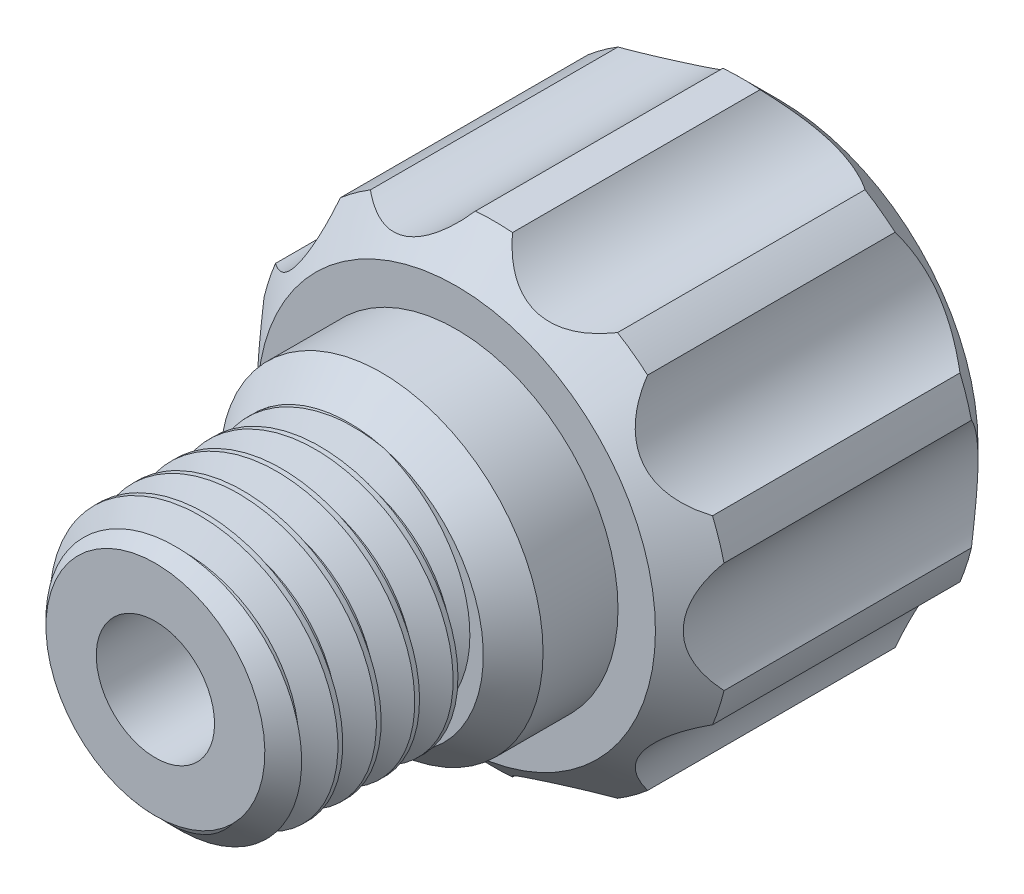
from build123d import *

# Parameters (mm, degrees)
SKETCH1_R           = 3.175
EXTRUDE1_DEPTH      = 4.572
CUT_SWEEP1_PITCH    = 0.907142857
EXTRUDE2_DEPTH      = 7.62
SKETCH10_R          = 3.817056353
CUT_EXTRUDE1_DEPTH  = 6.5024
BOSS_EXTRUDE2_REACH = 19.685
SKETCH11_R          = 2.0574
BOSS_EXTRUDE2_DRAFT = 1
SKETCH18_R          = 3.817056353
BOSS_EXTRUDE3_DEPTH = 1.770943647
SKETCH16_R          = 1.397
CUT_EXTRUDE2_DEPTH  = 18.685174916
SKETCH17_OUTSIDE_W  = 22.398
SKETCH17_OUTSIDE_H  = 22.706
SKETCH17_OUTSIDE_R  = 2.585793431
CUT_EXTRUDE3_DEPTH  = 2.54
CUT_EXTRUDE3_DRAFT  = -45


with BuildPart() as part:
    # Sketch1 → Extrude1 (new body)
    with BuildSketch(Plane.XY.offset(7.9375)):
        Circle(SKETCH1_R)
    extrude(amount=-EXTRUDE1_DEPTH)

    # Cut-Sweep1: the profile of Sketch3 profile screwed along a right-hand helix of 6.04 turns, 6 arcs to a turn; built about Z, then put on its axis
    cut_sweep1_z = Axis((0, 0, 0), (0, 0, 1))
    cut_sweep1_corners = [(3.1753, 0, -0.793923205), (2.585793431, 0, -0.453571429), (2.585793431, 0, -0.340178571), (3.1753, 0, 0.000173205)]
    with BuildLine(mode=Mode.PRIVATE) as cut_sweep1_profile:
        Line(cut_sweep1_corners[0], cut_sweep1_corners[1])
        Line(cut_sweep1_corners[1], cut_sweep1_corners[2])
        Line(cut_sweep1_corners[2], cut_sweep1_corners[3])
        Line(cut_sweep1_corners[3], cut_sweep1_corners[0])
    cut_sweep1_cap = Face(cut_sweep1_profile.wire())
    cut_sweep1_turn_angles = [0, 30, 60, 90, 120, 150, 180, 210, 240, 270, 300, 330, 360]
    cut_sweep1_turn_weights = [1, 0.8660254037844387, 1, 0.8660254037844387, 1, 0.8660254037844387, 1, 0.8660254037844387, 1, 0.8660254037844387, 1, 0.8660254037844387, 1]
    cut_sweep1_turn_rails = [Edge.make_bspline([Vector(p[0], p[1], 0).rotate(cut_sweep1_z, cut_sweep1_turn_angles[k]) / cut_sweep1_turn_weights[k] + Vector(0, 0, p[2] + CUT_SWEEP1_PITCH * cut_sweep1_turn_angles[k] / 360) for k in range(13)], [0, 0, 0, 1, 1, 2, 2, 3, 3, 4, 4, 5, 5, 6, 6, 6], 2, cut_sweep1_turn_weights) for p in cut_sweep1_corners]
    cut_sweep1_turn_sides = [Face.make_surface_from_curves(cut_sweep1_turn_rails[p[0]], cut_sweep1_turn_rails[p[1]]) for p in [(0, 1), (1, 2), (2, 3), (3, 0)]]
    cut_sweep1_last_angles = [2160, 2167.2, 2174.4]
    cut_sweep1_last_weights = [1, 0.9921147013144728, 1]
    cut_sweep1_last_rails = [Edge.make_bspline([Vector(p[0], p[1], 0).rotate(cut_sweep1_z, cut_sweep1_last_angles[k]) / cut_sweep1_last_weights[k] + Vector(0, 0, p[2] + CUT_SWEEP1_PITCH * cut_sweep1_last_angles[k] / 360) for k in range(3)], [0, 0, 0, 1, 1, 1], 2, cut_sweep1_last_weights) for p in cut_sweep1_corners]
    cut_sweep1_last_sides = [Face.make_surface_from_curves(cut_sweep1_last_rails[p[0]], cut_sweep1_last_rails[p[1]]) for p in [(0, 1), (1, 2), (2, 3), (3, 0)]]
    cut_sweep1 = Plane(origin=(0, 0, 7.9375), x_dir=(0, 1, 0), z_dir=(0, 0, -1)) * Solid(Shell([*[p.moved(Location((0, 0, CUT_SWEEP1_PITCH * i))) for i in range(6) for p in cut_sweep1_turn_sides], *cut_sweep1_last_sides, cut_sweep1_cap, cut_sweep1_cap.rotate(cut_sweep1_z, 2174.4).moved(Location((0, 0, CUT_SWEEP1_PITCH * 2174.4 / 360)))]))
    add(cut_sweep1, mode=Mode.SUBTRACT)



with BuildPart() as body_2:
    # Sketch6 → Extrude2 (new body)
    with BuildSketch(Plane(origin=(0, 0, 0.8255), x_dir=(-1, 0, 0), z_dir=(0, 0, -1))):
        with BuildLine():
            ThreePointArc((-0.438429427, 5.570774061), (0, 5.588), (0.438429427, 5.570774061))
            ThreePointArc((0.438429427, 5.570774061), (1.554108268, 4.783053432), (2.91972198, 4.764553238))
            ThreePointArc((2.91972198, 4.764553238), (3.28454399, 4.520786965), (3.629115694, 4.249148536))
            ThreePointArc((3.629115694, 4.249148536), (4.068708268, 2.956089591), (5.162638828, 2.13843502))
            ThreePointArc((5.162638828, 2.13843502), (5.314503813, 1.726786965), (5.433603115, 1.304492693))
            ThreePointArc((5.433603115, 1.304492693), (5.0292, 0), (5.433603115, -1.304492693))
            ThreePointArc((5.433603115, -1.304492693), (5.314503813, -1.726786965), (5.162638828, -2.13843502))
            ThreePointArc((5.162638828, -2.13843502), (4.068708268, -2.956089591), (3.629115694, -4.249148536))
            ThreePointArc((3.629115694, -4.249148536), (3.28454399, -4.520786965), (2.91972198, -4.764553238))
            ThreePointArc((2.91972198, -4.764553238), (1.554108268, -4.783053432), (0.438429427, -5.570774061))
            ThreePointArc((0.438429427, -5.570774061), (0, -5.588), (-0.438429427, -5.570774061))
            ThreePointArc((-0.438429427, -5.570774061), (-1.554108268, -4.783053432), (-2.91972198, -4.764553238))
            ThreePointArc((-2.91972198, -4.764553238), (-3.28454399, -4.520786965), (-3.629115694, -4.249148536))
            ThreePointArc((-3.629115694, -4.249148536), (-4.068708268, -2.956089591), (-5.162638828, -2.13843502))
            ThreePointArc((-5.162638828, -2.13843502), (-5.314503813, -1.726786965), (-5.433603115, -1.304492693))
            ThreePointArc((-5.433603115, -1.304492693), (-5.0292, 0), (-5.433603115, 1.304492693))
            ThreePointArc((-5.433603115, 1.304492693), (-5.314503813, 1.726786965), (-5.162638828, 2.13843502))
            ThreePointArc((-5.162638828, 2.13843502), (-4.068708268, 2.956089591), (-3.629115694, 4.249148536))
            ThreePointArc((-3.629115694, 4.249148536), (-3.28454399, 4.520786965), (-2.91972198, 4.764553238))
            ThreePointArc((-2.91972198, 4.764553238), (-1.554108268, 4.783053432), (-0.438429427, 5.570774061))
        make_face()
    extrude(amount=EXTRUDE2_DEPTH)

    # Sketch10 → Cut-Extrude1 (cut)
    with BuildSketch(Plane(origin=(0, 0, -6.7945), x_dir=(-1, 0, 0), z_dir=(0, 0, -1))):
        Circle(SKETCH10_R)
    extrude(amount=-CUT_EXTRUDE1_DEPTH, mode=Mode.SUBTRACT)




with BuildPart() as boss_extrude2_long_prism_1:
    # Sketch11 → Boss-Extrude2 (the long prism of profile 1, to be tilted and cut off)
    with BuildSketch(Plane(origin=(0, 0, -7.9375), x_dir=(-1, 0, 0), z_dir=(0, 0, -1))):
        Circle(SKETCH11_R)
    extrude(amount=-BOSS_EXTRUDE2_REACH)
    boss_extrude2_tool1_sides = [boss_extrude2_long_prism_1.faces().sort_by_distance(p)[0] for p in [
        (2.0574, 0, 1.905),
    ]]
    draft(boss_extrude2_tool1_sides, Plane(origin=(0, 0, -7.9375), x_dir=(-1, 0, 0), z_dir=(0, 0, -1)), BOSS_EXTRUDE2_DRAFT)  # the draft: side faces tilted about the start plane


with BuildPart() as body_2_1:
    add(body_2.part)
    boss_extrude2_tool1 = boss_extrude2_long_prism_1.part - body_2.part
    add(boss_extrude2_tool1.solids().sort_by_distance((0, 0, -7.9375))[0])

    # Sketch18 → Boss-Extrude3 (add)
    with BuildSketch(Plane.XY.offset(0.8255)):
        with Locations(Location((0, 0, 0), (0, 0, 180))):
            Circle(SKETCH18_R)
    extrude(amount=BOSS_EXTRUDE3_DEPTH)


with BuildPart() as part_1:
    add(part.part)

    add(body_2_1.part)  # Revolve1 merges body 2
    # Sketch15 → Revolve1 (revolve)
    with BuildSketch(Plane(origin=(0, 0, 0), x_dir=(0, 0, -1), z_dir=(1, 0, 0)), mode=Mode.PRIVATE) as revolve1_sk:
        Polygon((-3.3655, 0), (-3.3655, 3.175), (-2.596443647, 3.817056353), (-2.596443647, 0), align=None)
    revolve(revolve1_sk.sketch.rotate(Axis((0, 0, 7.9375), (0, 0, -1)), 14.929937855), axis=Axis((0, 0, 7.9375), (0, 0, -1)))

    # Sketch16 → Cut-Extrude2 (cut, through all)
    with BuildSketch(Plane.XY.offset(7.9375)):
        Circle(SKETCH16_R)
    extrude(amount=-CUT_EXTRUDE2_DEPTH, mode=Mode.SUBTRACT)


with BuildPart() as cut_extrude3_tool:
    # Sketch17 outside → Cut-Extrude3 (with draft: the straight prism first)
    with BuildSketch(Plane.XY.offset(7.9375)):
        Rectangle(SKETCH17_OUTSIDE_W, SKETCH17_OUTSIDE_H)
        Circle(SKETCH17_OUTSIDE_R, mode=Mode.SUBTRACT)
    extrude(amount=-CUT_EXTRUDE3_DEPTH)
    # Cut-Extrude3: the draft: its side faces are tilted about the plane it starts from
    cut_extrude3_sides = [cut_extrude3_tool.faces().sort_by_distance(p)[0] for p in [
        (0, -11.353, 6.6675),
        (11.199, 0, 6.6675),
        (0, 11.353, 6.6675),
        (-11.199, 0, 6.6675),
        (-2.585793431, 0, 6.6675),
    ]]
    draft(cut_extrude3_sides, Plane.XY.offset(7.9375), CUT_EXTRUDE3_DRAFT)


with BuildPart() as part_2:
    add(part_1.part)

    # Cut-Extrude3: cut by cut_extrude3_tool
    add(cut_extrude3_tool.part, mode=Mode.SUBTRACT)

    # Sketch19 → Cut-Revolve1 (revolve, cut)
    with BuildSketch(Plane(origin=(0, 0, 0), x_dir=(0, 0, -1), z_dir=(1, 0, 0)), mode=Mode.PRIVATE) as cut_revolve1_sk:
        Polygon((6.7945, 4.701053238), (5.907553238, 5.588), (6.7945, 5.588), align=None)
        Polygon((-0.8255, 5.588), (-0.8255, 4.701053238), (0.061446762, 5.588), align=None)
    revolve(cut_revolve1_sk.sketch.rotate(Axis((0, 0, 7.9375), (0, 0, -1)), 90), axis=Axis((0, 0, 7.9375), (0, 0, -1)), mode=Mode.SUBTRACT)


solid = part_2.part
